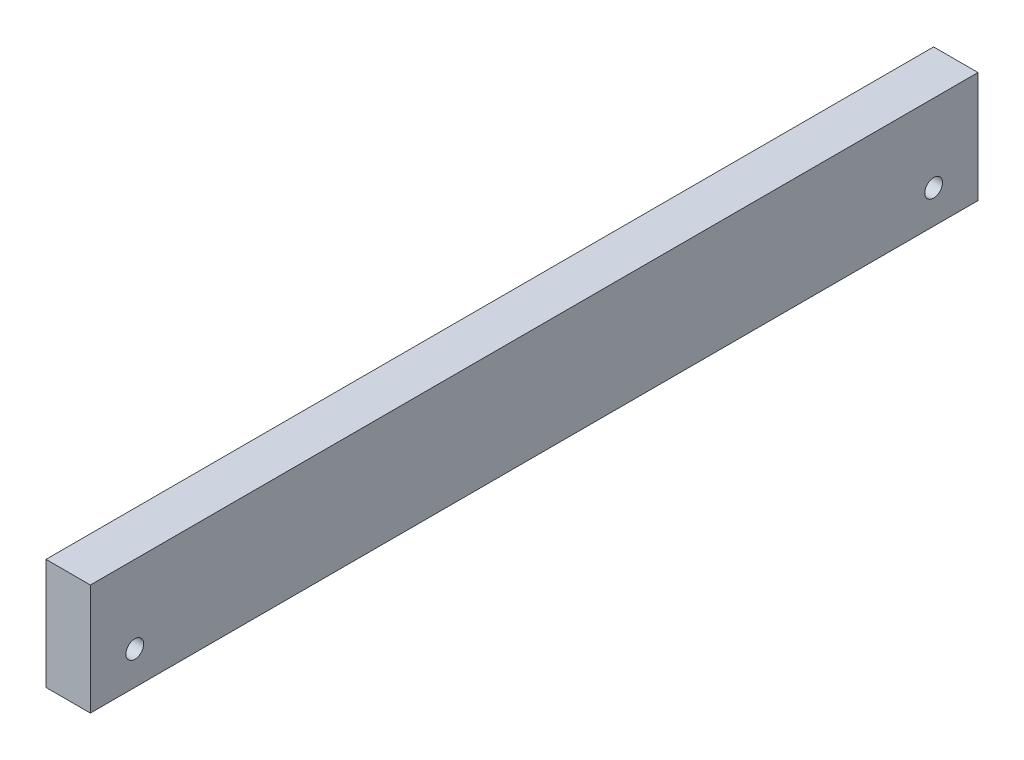
from build123d import *

# Parameters (mm, degrees)
SKETCH1_W                = 20
SKETCH1_H                = 50
EXTRUDE1_DEPTH           = 400
F_8_0_8_DIAMETER_HOLE1_D = 8


with BuildPart() as part:
    # Sketch1 → Extrude1 (new body)
    with BuildSketch(Plane.XY):
        with Locations((10, 25)):
            Rectangle(SKETCH1_W, SKETCH1_H)
    extrude(amount=EXTRUDE1_DEPTH)

    # Ø8.0 (8) Diameter Hole1 (through all)
    with Locations(Plane(origin=(20, 15, 380), x_dir=(0, 0, 1), z_dir=(1, 0, 0))):
        with Locations((0, 0), (-360, 0)):
            Hole(F_8_0_8_DIAMETER_HOLE1_D / 2)


solid = part.part
